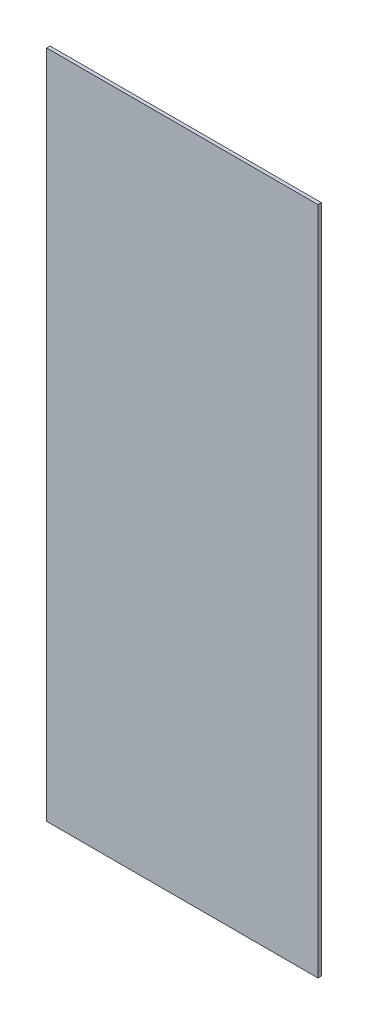
from build123d import *

# Parameters (mm, degrees)
SKETCH1_W           = 162
SKETCH1_H           = 400
BOSS_EXTRUDE1_DEPTH = 2


with BuildPart() as part:
    # Sketch1 → Boss-Extrude1 (new body)
    with BuildSketch(Plane.XY):
        Rectangle(SKETCH1_W, SKETCH1_H)
    extrude(amount=BOSS_EXTRUDE1_DEPTH)


solid = part.part
